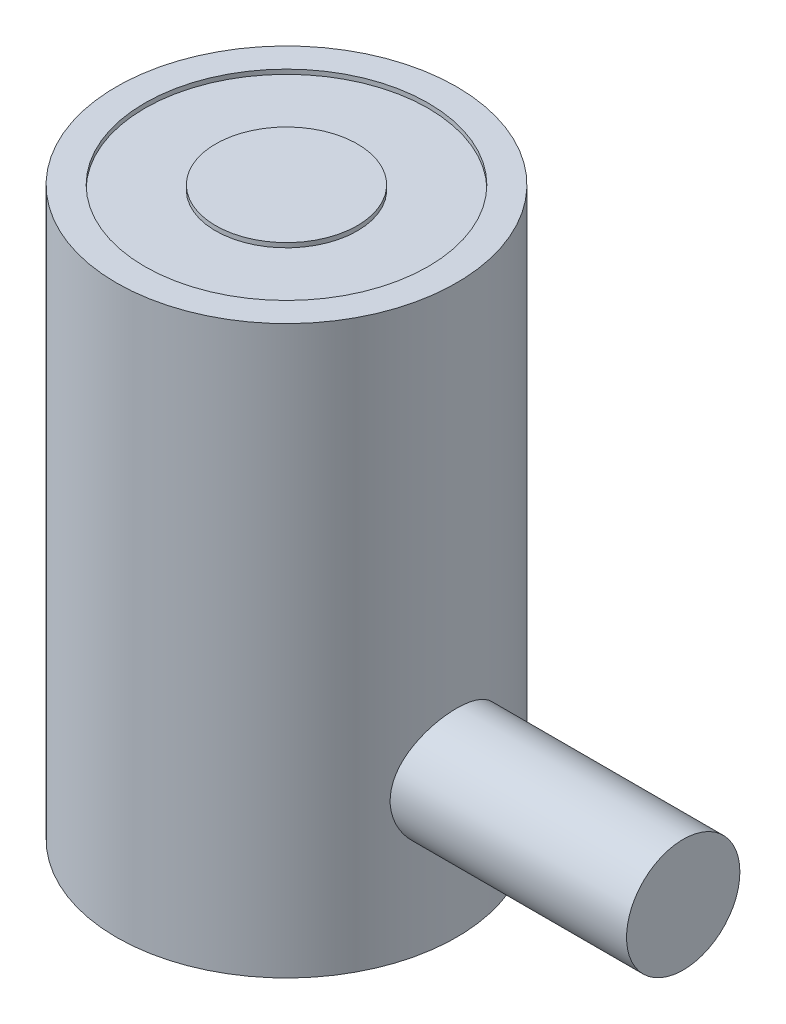
from build123d import *

# Parameters (mm, degrees)
SKETCH1_R                    = 9.525
BOSS_EXTRUDE1_DEPTH          = 31.75
SKETCH2_W                    = 3.96875
SKETCH2_H                    = 0.254
SKETCH3_R                    = 2.413
CUT_EXTRUDE1_DEPTH           = 9.525
SWEEP1_PITCH                 = 0.79375
SKETCH6_R                    = 2.498925958
CUT_EXTRUDE2_OTHER_WAY_DEPTH = 35.489328115
BOSS_EXTRUDE2_START          = 22.225
SKETCH7_R                    = 3.175
BOSS_EXTRUDE2_DEPTH          = 13.244743879


with BuildPart() as part:
    # Sketch1 → Boss-Extrude1 (new body)
    with BuildSketch(Plane(origin=(0, 0, 0), x_dir=(1, 0, 0), z_dir=(0, 1, 0))):
        with Locations(Location((0, 0, 0), (0, 0, 270))):
            Circle(SKETCH1_R)
    extrude(amount=BOSS_EXTRUDE1_DEPTH)

    # Sketch2 → Cut-Revolve1 (revolve, cut)
    with BuildSketch(Plane.XY, mode=Mode.PRIVATE) as cut_revolve1_sk:
        with Locations((-5.953125, 31.623)):
            Rectangle(SKETCH2_W, SKETCH2_H)
    revolve(cut_revolve1_sk.sketch.rotate(Axis((0, 0, 0), (0, 1, 0)), 180), axis=Axis((0, 0, 0), (0, 1, 0)), mode=Mode.SUBTRACT)

    # Sketch3 → Cut-Extrude1 (cut)
    with BuildSketch(Plane.XZ):
        with Locations(Location((0, 0, 0), (0, 0, 270))):
            Circle(SKETCH3_R)
    extrude(amount=-CUT_EXTRUDE1_DEPTH, mode=Mode.SUBTRACT)

    # Sweep1: the profile of Sketch5 screwed along a right-hand helix of 13 turns, 8 arcs to a turn; built about Z, then put on its axis
    sweep1_z = Axis((0, 0, 0), (0, 0, 1))
    sweep1_corners = [(2.455962979, 0, -0.719335938), (2.455962979, 0, 0.024804688), (1.98337021, 0, -0.248046875), (1.98337021, 0, -0.446484375)]
    with BuildLine(mode=Mode.PRIVATE) as sweep1_profile:
        Line(sweep1_corners[0], sweep1_corners[1])
        Line(sweep1_corners[1], sweep1_corners[2])
        Line(sweep1_corners[2], sweep1_corners[3])
        Line(sweep1_corners[3], sweep1_corners[0])
    sweep1_cap = Face(sweep1_profile.wire())
    sweep1_turn_angles = [0, 22.5, 45, 67.5, 90, 112.5, 135, 157.5, 180, 202.5, 225, 247.5, 270, 292.5, 315, 337.5, 360]
    sweep1_turn_weights = [1, 0.9238795325112867, 1, 0.9238795325112867, 1, 0.9238795325112867, 1, 0.9238795325112867, 1, 0.9238795325112867, 1, 0.9238795325112867, 1, 0.9238795325112867, 1, 0.9238795325112867, 1]
    sweep1_turn_rails = [Edge.make_bspline([Vector(p[0], p[1], 0).rotate(sweep1_z, sweep1_turn_angles[k]) / sweep1_turn_weights[k] + Vector(0, 0, p[2] + SWEEP1_PITCH * sweep1_turn_angles[k] / 360) for k in range(17)], [0, 0, 0, 1, 1, 2, 2, 3, 3, 4, 4, 5, 5, 6, 6, 7, 7, 8, 8, 8], 2, sweep1_turn_weights) for p in sweep1_corners]
    sweep1_turn_sides = [Face.make_surface_from_curves(sweep1_turn_rails[p[0]], sweep1_turn_rails[p[1]]) for p in [(0, 1), (1, 2), (2, 3), (3, 0)]]
    sweep1 = Plane(origin=(0, 0, 0), x_dir=(-1, 0, 0), z_dir=(0, 1, 0)) * Solid(Shell([*[p.moved(Location((0, 0, SWEEP1_PITCH * i))) for i in range(13) for p in sweep1_turn_sides], sweep1_cap, sweep1_cap.rotate(sweep1_z, 4680).moved(Location((0, 0, SWEEP1_PITCH * 4680 / 360)))]))
    add(sweep1)

    # Cut-Extrude2 cone 1 section (through the dimple's axis) → Cut-Extrude2 (revolve, cut)
    with BuildSketch(Plane(origin=(0, 0, 0), x_dir=(0, 0, -1), z_dir=(1, 0, 0))):
        Polygon((0, 0), (2.498925958, 0), (0, 2.498925958), align=None)
    revolve(axis=Axis((0, 0, 0), (0, 1, 0)), mode=Mode.SUBTRACT)

    # Sketch6 → Cut-Extrude2 other way (cut)
    with BuildSketch(Plane.XZ):
        Circle(SKETCH6_R)
    extrude(amount=CUT_EXTRUDE2_OTHER_WAY_DEPTH, mode=Mode.SUBTRACT)

    # Sketch7 → Boss-Extrude2 (add)
    with BuildSketch(Plane(origin=(0, 0, 0), x_dir=(0, 0, -1), z_dir=(1, 0, 0)).offset(BOSS_EXTRUDE2_START)):
        with Locations((0, 7.9375)):
            Circle(SKETCH7_R)
    extrude(amount=-BOSS_EXTRUDE2_DEPTH)


solid = part.part
